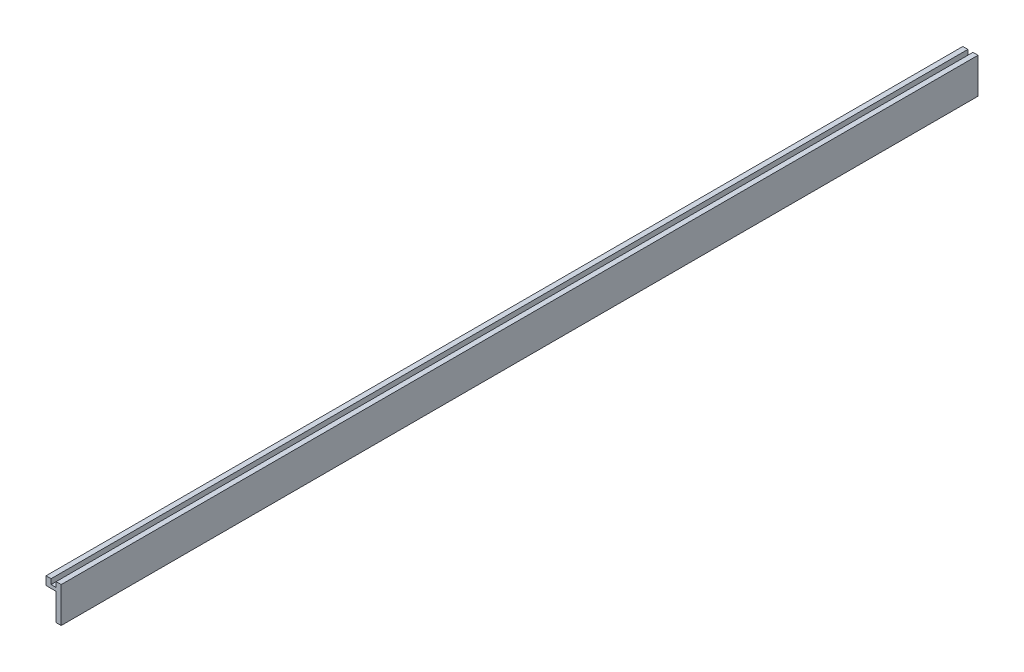
from build123d import *

# Parameters (mm, degrees)
BOSS_EXTRUDE1_DEPTH = 904
SKETCH4_W           = 904
SKETCH4_H           = 26.674416974
CUT_EXTRUDE3_DEPTH  = 10
SKETCH7_R           = 5
BOSS_EXTRUDE4_DEPTH = 5


with BuildPart() as part:
    # Sketch1 → Boss-Extrude1 (new body)
    with BuildSketch(Plane.XY):
        Polygon((0, 35), (5, 35), (5, 30), (10, 30), (10, 35), (15, 35), (15, 0), (0, 0), align=None)
    extrude(amount=BOSS_EXTRUDE1_DEPTH)

    # Sketch4 → Cut-Extrude3 (cut)
    with BuildSketch(Plane.ZY):
        with Locations((452, 13.337208487)):
            Rectangle(SKETCH4_W, SKETCH4_H)
    extrude(amount=-CUT_EXTRUDE3_DEPTH, mode=Mode.SUBTRACT)

    # Sketch7 → Boss-Extrude4 (add)
    with BuildSketch(Plane.ZY.offset(-10)):
        with Locations((304, 12.5)):
            Circle(SKETCH7_R)
    extrude(amount=BOSS_EXTRUDE4_DEPTH)


solid = part.part
